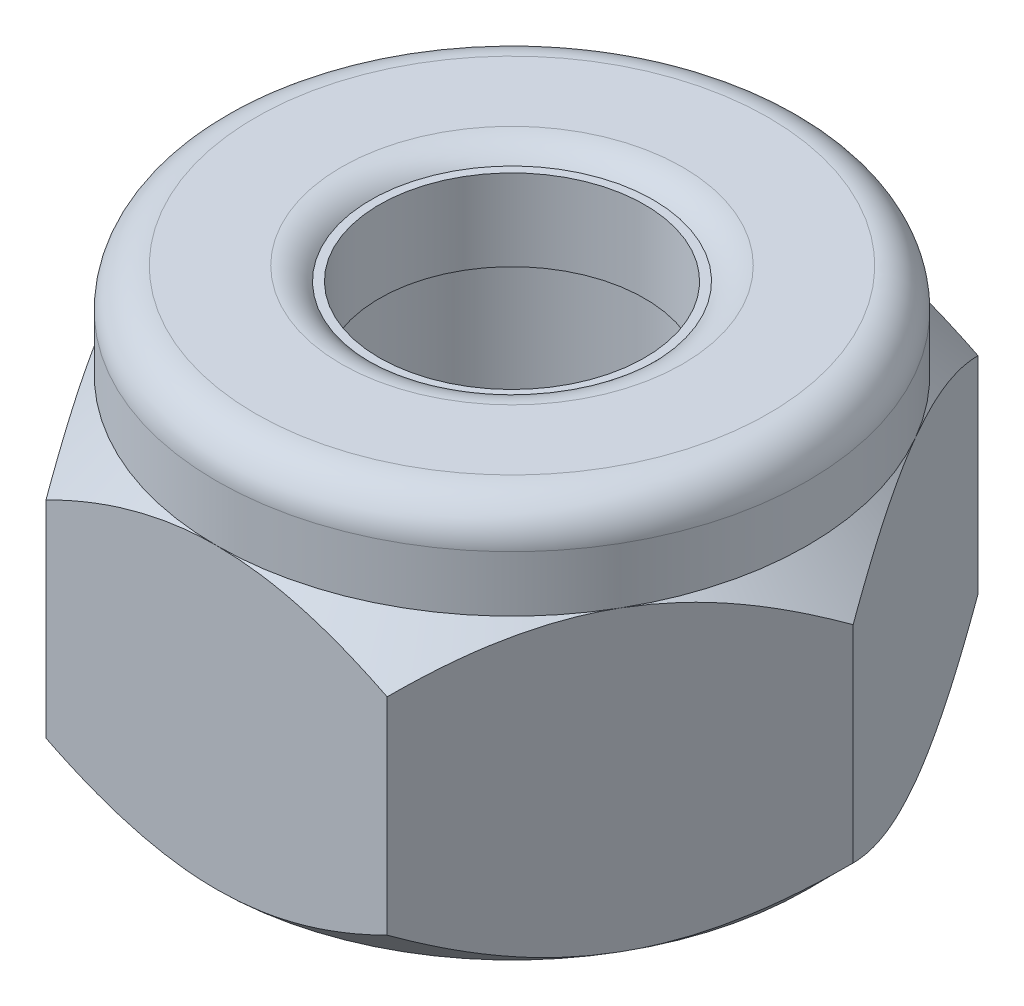
from build123d import *

# Parameters (mm, degrees)
EXTRUDE_1_DEPTH     = 2.2
SKETCH_3_R          = 4.365
EXTRUDE_2_DEPTH     = 1.4
SKETCH_4_R          = 2.085
CUT_EXTRUDE_1_DEPTH = 9.837280407
EXTRUDE_START       = -0.2
SKETCH_5_R          = 2.085
SKETCH_5_R_2        = 1.96
EXTRUDE_3_DEPTH     = 1.2
FILLET_1_R          = 0.575


with BuildPart() as part:
    # 草图1 → 凸台-拉伸1 (new, symmetric)
    with BuildSketch(Plane(origin=(0, 0, 0), x_dir=(1, 0, 0), z_dir=(0, 1, 0))):
        Polygon((5.04026785, 0), (2.520133925, 4.365), (-2.520133925, 4.365), (-5.04026785, 0), (-2.520133925, -4.365), (2.520133925, -4.365), align=None)
    extrude(amount=EXTRUDE_1_DEPTH, both=True)

    # 草图3 → 凸台-拉伸2 (add)
    with BuildSketch(Plane(origin=(0, 2.2, 0), x_dir=(1, 0, 0), z_dir=(0, 1, 0))):
        with Locations(Location((0, 0, 0), (0, 0, 270))):
            Circle(SKETCH_3_R)
    extrude(amount=EXTRUDE_2_DEPTH)

    # 草图4 → 切除-拉伸1 (cut, through all)
    with BuildSketch(Plane(origin=(0, 3.6, 0), x_dir=(1, 0, 0), z_dir=(0, 1, 0))):
        with Locations(Location((0, 0, 0), (0, 0, 270))):
            Circle(SKETCH_4_R)
    extrude(amount=-CUT_EXTRUDE_1_DEPTH, mode=Mode.SUBTRACT)

    # 草图5 → 凸台-拉伸3 (add)
    with BuildSketch(Plane(origin=(0, 3.6, 0), x_dir=(1, 0, 0), z_dir=(0, 1, 0)).offset(EXTRUDE_START)):
        with Locations(Location((0, 0, 0), (0, 0, 270))):
            Circle(SKETCH_5_R)
        with Locations(Location((0, 0, 0), (0, 0, 270))):
            Circle(SKETCH_5_R_2, mode=Mode.SUBTRACT)
    extrude(amount=-EXTRUDE_3_DEPTH)

    # 圆角1
    # the kernel refuses this fillet: 0.575 mm, written as the material it takes off along each edge
    with BuildSketch(Plane(origin=(0, 3.6, 0), x_dir=(0, 0, 1), z_dir=(-1, 0, 0))) as fillet_1_piece_1:
        with BuildLine():
            CenterArc((4.365 - FILLET_1_R, -FILLET_1_R), FILLET_1_R, 0, 90)
            Line((4.365 - FILLET_1_R, 0), (4.365 - FILLET_1_R, FILLET_1_R * 0.02))
            Line((4.365 - FILLET_1_R, FILLET_1_R * 0.02), (4.365 + FILLET_1_R * 0.02, FILLET_1_R * 0.02))
            Line((4.365 + FILLET_1_R * 0.02, FILLET_1_R * 0.02), (4.365 + FILLET_1_R * 0.02, -FILLET_1_R))
            Line((4.365 + FILLET_1_R * 0.02, -FILLET_1_R), (4.365, -FILLET_1_R))
        make_face()
    revolve(axis=Axis((0, 3.6, 0), (0, 1, 0)), mode=Mode.SUBTRACT)
    with BuildSketch(Plane(origin=(0, 3.6, 0), x_dir=(0, 0, 1), z_dir=(-1, 0, 0))) as fillet_1_piece_2:
        with BuildLine():
            CenterArc((2.520889894, -0.575), FILLET_1_R, 90, 49.294293169)
            Line((2.085, -0.2), (2.076282202, -0.1925))
            ThreePointArc((2.076282202, -0.1925), (2.0735, -0.1), (2.0735, 0))
            Line((2.0735, 0), (2.085, 0.0115))
            Line((2.085, 0.0115), (2.520889894, 0.0115))
            Line((2.520889894, 0.0115), (2.520889894, 0))
        make_face()
    revolve(axis=Axis((0, 3.6, 0), (0, 1, 0)), mode=Mode.SUBTRACT)

    # 草图6 → 切除-旋转1 (revolve, cut)
    with BuildSketch(Plane.XY):
        Polygon((-5.04026785, 2.2), (-5.04026785, 1.52473215), (-4.365, 2.2), align=None)
        Polygon((-5.04026785, -2.2), (-5.04026785, -1.52473215), (-4.365, -2.2), align=None)
    revolve(axis=Axis((0, -1000, 0), (0, 1, 0)), mode=Mode.SUBTRACT)


solid = part.part
